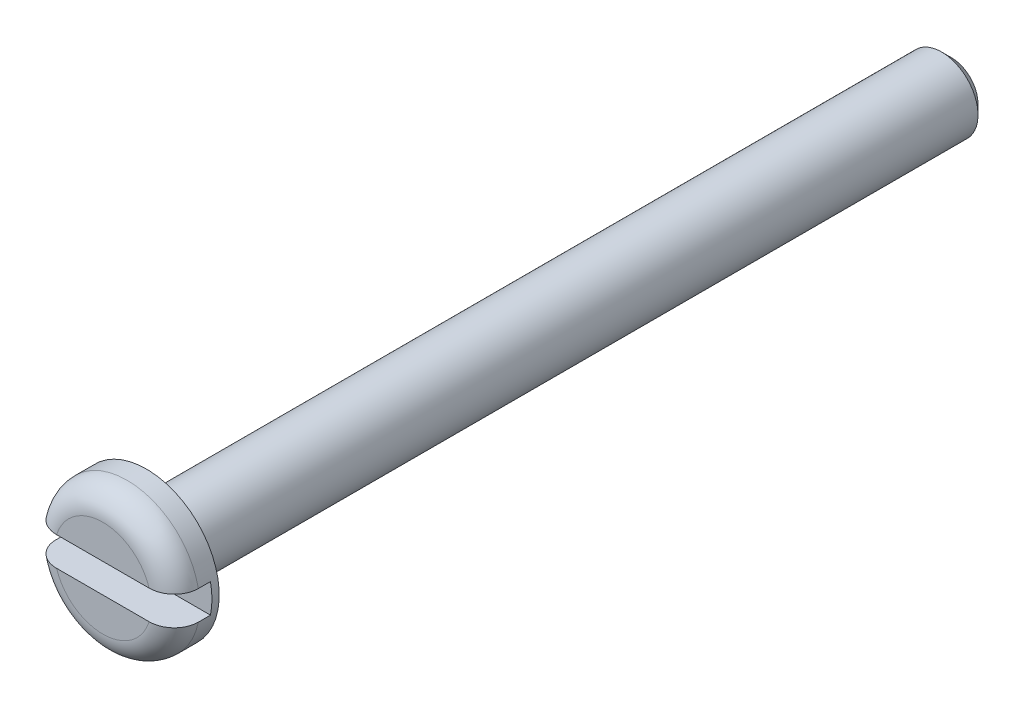
from build123d import *

# Parameters (mm, degrees)
CUT_EXTRUDE_1_DEPTH      = 36.256205128
CUT_EXTRUDE_1_DEPTH_BACK = 36.256205128
SKETCH_2_W               = 1.5
SKETCH_2_H               = 1.2
CHAMFER_1_SIZE           = 0.4
FILLET_1_R               = 1
FILLET_2_R               = 0.4


with BuildPart() as part:
    # Эскиз1 → Повернуть1 (revolve)
    with BuildSketch(Plane(origin=(0, 0, 0), x_dir=(1, 0, 0), z_dir=(0, 1, 0))):
        Polygon((0, 0), (-3, 0), (-3, 1.8), (-1.5, 1.8), (-1.5, 35), (0, 35), align=None)
    revolve(axis=Axis((0, 0, -35), (0, 0, 1)))

    # Эскиз2 → Вырез-Вытянуть1 (cut, two sides: drawn at the far end of the back side and taken through both)
    with BuildSketch(Plane(origin=(0, 0, 0), x_dir=(0, 0, -1), z_dir=(1, 0, 0)).offset(-CUT_EXTRUDE_1_DEPTH_BACK)):
        with Locations((0.75, 0)):
            Rectangle(SKETCH_2_W, SKETCH_2_H)
    extrude(amount=CUT_EXTRUDE_1_DEPTH + CUT_EXTRUDE_1_DEPTH_BACK, mode=Mode.SUBTRACT)

    # Фаска1
    chamfer_1_edges = [part.edges().sort_by_distance(p)[0] for p in [
        (1.5, 0, -35),
    ]]
    chamfer(chamfer_1_edges, length=CHAMFER_1_SIZE)

    # Скругление1
    fillet_1_edges = [part.edges().sort_by_distance(p)[0] for p in [
        (0, -3, 0),
        (0, 3, 0),
    ]]
    fillet(fillet_1_edges, radius=FILLET_1_R)

    # Скругление2
    fillet_2_edges = [part.edges().sort_by_distance(p)[0] for p in [
        (1.5, 0, -1.8),
    ]]
    fillet(fillet_2_edges, radius=FILLET_2_R)


solid = part.part
